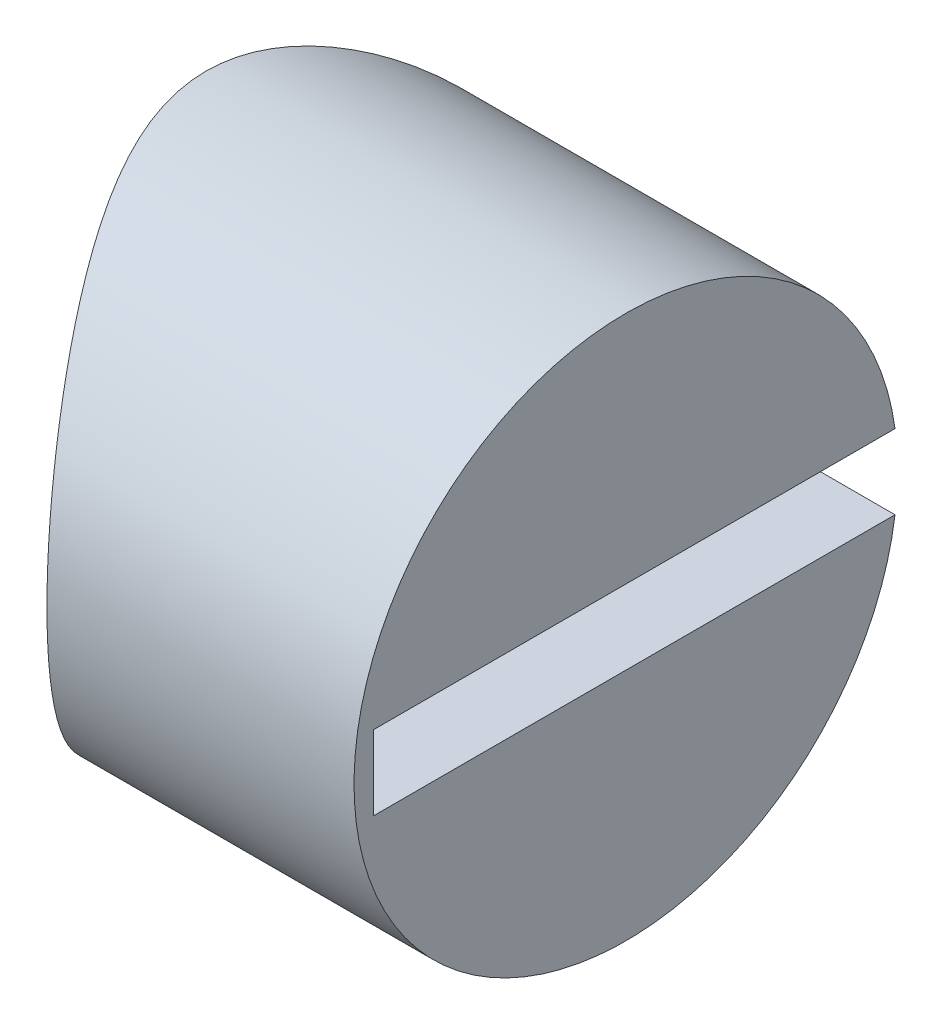
from build123d import *

# Parameters (mm, degrees)
SKETCH1_R                 = 18.25
SKETCH1_R_2               = 13.5
BOSS_EXTRUDE1_DEPTH       = 6
CUT_EXTRUDE2_REACH        = 29.498
CUT_EXTRUDE2_START_RADIUS = 18.25
CUT_EXTRUDE2_END_RADIUS   = 18.25
SKETCH6_W                 = 6
SKETCH6_H                 = 0.651674146
SKETCH3_R                 = 3
CUT_EXTRUDE1_START        = -18.2500001
CUT_EXTRUDE1_OUTLINE_W    = 40
CUT_EXTRUDE1_OUTLINE_H    = 6
CUT_EXTRUDE1_OUTLINE_R    = 2.375
CUT_EXTRUDE1_DEPTH        = 36.5000001
CUT_EXTRUDE1_2_OUTLINE_R  = 2.375
CUT_EXTRUDE1_2_DEPTH      = 4.75
CUT_EXTRUDE4_START        = 18
SKETCH7_W                 = 5.736434108
SKETCH7_H                 = 5.158562368
CUT_EXTRUDE4_DEPTH        = 20


# Read off the part's stored shape, not the designer's step: Cut-Extrude1
with BuildPart() as part:
    # Sketch1 → Boss-Extrude1 (new body)
    with BuildSketch(Plane(origin=(0, 0, 0), x_dir=(1, 0, 0), z_dir=(0, 1, 0))):
        with Locations(Location((0, 0, 0), (0, 0, 270))):
            Circle(SKETCH1_R)
        with Locations(Location((0, 0, 0), (0, 0, 270))):
            Circle(SKETCH1_R_2, mode=Mode.SUBTRACT)
    extrude(amount=BOSS_EXTRUDE1_DEPTH)

    # Cut-Extrude2: from a cylinder face, 29.498 long prism both ways, kept between that surface and its translate by the depth
    cut_extrude2_start = Plane(origin=(0, 3, 0), z_dir=(0, -1, 0)) * Cylinder(CUT_EXTRUDE2_START_RADIUS, 96.496, mode=Mode.PRIVATE)
    cut_extrude2_end = Plane(origin=(-1, 3, 0), z_dir=(0, -1, 0)) * Cylinder(CUT_EXTRUDE2_END_RADIUS, 96.496, mode=Mode.PRIVATE)
    # Sketch6 → Cut-Extrude2 (cut, from a surface)
    with BuildSketch(Plane(origin=(0, 0, 0), x_dir=(0, 0, -1), z_dir=(1, 0, 0)), mode=Mode.PRIVATE) as cut_extrude2_sk1:
        with Locations((0.79691987, 3)):
            Rectangle(SKETCH6_W, SKETCH6_H)
    cut_extrude2_tool1 = extrude(cut_extrude2_sk1.sketch, amount=CUT_EXTRUDE2_REACH, both=True, mode=Mode.PRIVATE)
    add(((cut_extrude2_tool1 & cut_extrude2_start) - cut_extrude2_end).solids().sort_by_distance((17.483597, 3, -0.79692))[0], mode=Mode.SUBTRACT)

    # Sketch3 → Cut-Revolve1 (revolve, cut)
    with BuildSketch(Plane.XY, mode=Mode.PRIVATE) as cut_revolve1_sk:
        with Locations((-12.5, 3)):
            Circle(SKETCH3_R)
    revolve(cut_revolve1_sk.sketch.rotate(Axis((0, 0, 0), (0, 1, 0)), 270), axis=Axis((0, 0, 0), (0, 1, 0)), mode=Mode.SUBTRACT)

    # Cut-Extrude1 outline → Cut-Extrude1 (cut)
    with BuildSketch(Plane(origin=(0, 0, 0), x_dir=(0, 0, -1), z_dir=(1, 0, 0)).offset(CUT_EXTRUDE1_START)):
        with Locations((0, 3)):
            Rectangle(CUT_EXTRUDE1_OUTLINE_W, CUT_EXTRUDE1_OUTLINE_H)
        with Locations((0, 3)):
            Circle(CUT_EXTRUDE1_OUTLINE_R, mode=Mode.SUBTRACT)
    extrude(amount=CUT_EXTRUDE1_DEPTH, mode=Mode.SUBTRACT)

    # Cut-Extrude1 2 outline → Cut-Extrude1 2 (cut)
    with BuildSketch(Plane(origin=(0, 0, 0), x_dir=(0, 0, -1), z_dir=(1, 0, 0)).offset(CUT_EXTRUDE1_START)):
        with Locations((0, 3)):
            Circle(CUT_EXTRUDE1_2_OUTLINE_R)
    extrude(amount=CUT_EXTRUDE1_2_DEPTH, mode=Mode.SUBTRACT)

    # Sketch7 → Cut-Extrude4 (cut)
    with BuildSketch(Plane(origin=(0, 0, 0), x_dir=(0, 0, -1), z_dir=(1, 0, 0)).offset(CUT_EXTRUDE4_START)):
        with Locations((0, 3.03875969)):
            Rectangle(SKETCH7_W, SKETCH7_H)
    extrude(amount=CUT_EXTRUDE4_DEPTH, mode=Mode.SUBTRACT)


solid = part.part
